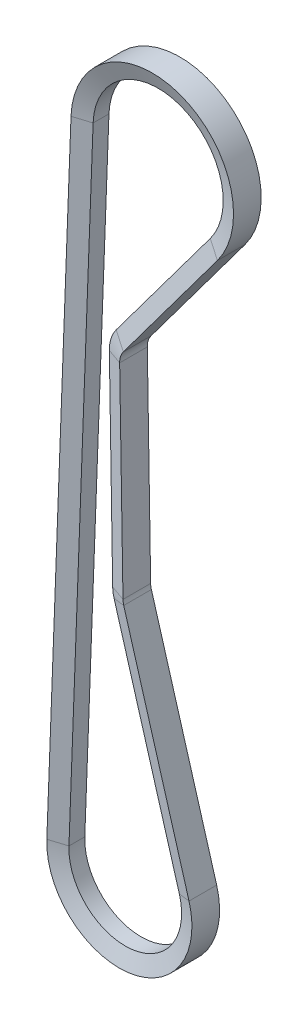
from build123d import *


with BuildPart() as part:
    # Sweep1: sweep along a path in Sketch2
    with BuildLine(Plane.XY) as sweep1_path:
        Line((-24.982079985, 0.946403527), (-16.654503317, 220.768266559))
        ThreePointArc((-16.654503317, 220.768266559), (20.644327768, 246.112045759), (33.772139879, 202.970760502))
        Line((33.772139879, 202.970760502), (1.364596527, 159.508991291))
        ThreePointArc((1.364596527, 159.508991291), (0.412115638, 157.663477154), (0.106039154, 155.609344866))
        Line((0.106039154, 155.609344866), (1.250432194, 85.61870003))
        ThreePointArc((1.250432194, 85.61870003), (1.321264066, 84.771090478), (1.504740426, 83.940551176))
        Line((1.504740426, 83.940551176), (23.99544536, 7.015597051))
        ThreePointArc((23.99544536, 7.015597051), (3.074433197, -24.810237011), (-24.982079985, 0.946403527))
    # Sketch3 → Sweep1 (sweep)
    with BuildSketch(Plane(origin=(23.99544536, 7.015597051, 0), x_dir=(-0.9598178143887309, -0.280623882059314, 0), z_dir=(0.280623882059314, -0.9598178143887309, 0))):
        Polygon((0, -4.7625), (0, 4.7625), (5.588, 2.728634331), (5.588, -2.728634331), align=None)
    sweep(path=sweep1_path.line)


solid = part.part
